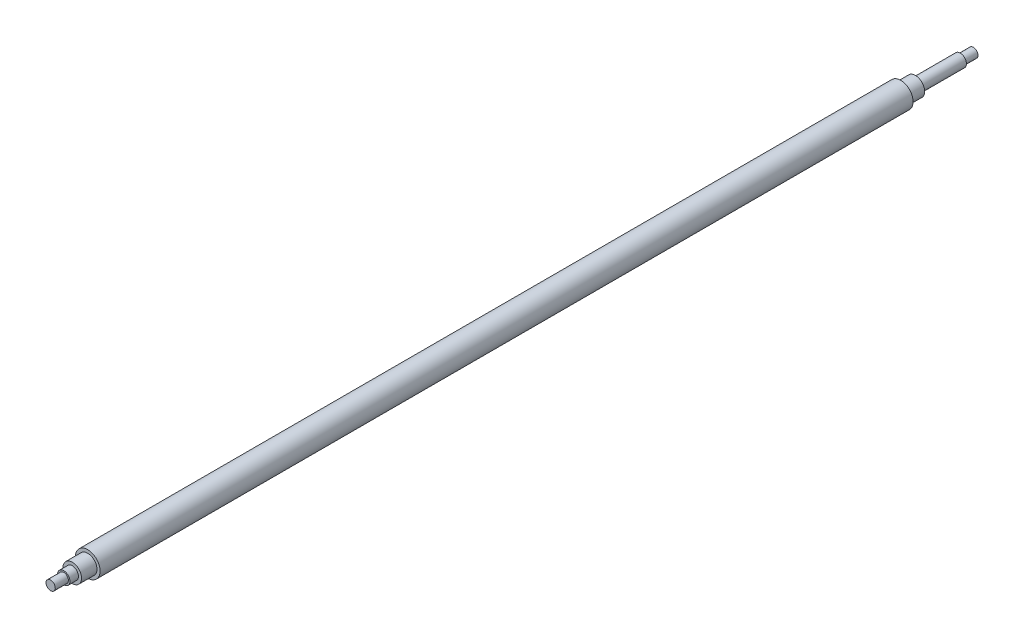
from build123d import *


with BuildPart() as part:
    # Schizzo2 → Rivoluzione2 (revolve)
    with BuildSketch(Plane(origin=(0, 0, 0), x_dir=(0, 0, -1), z_dir=(1, 0, 0))):
        Polygon((0, 0), (0, 3), (8.5, 3), (8.5, 4), (14, 4), (14, 6), (24, 6), (24, 8), (550, 8), (550, 6), (559.5, 6), (559.5, 4), (588.5, 4), (588.5, 3), (597, 3), (597, 0), align=None)
    revolve(axis=Axis((0, 0, 0), (0, 0, -1)))


solid = part.part
